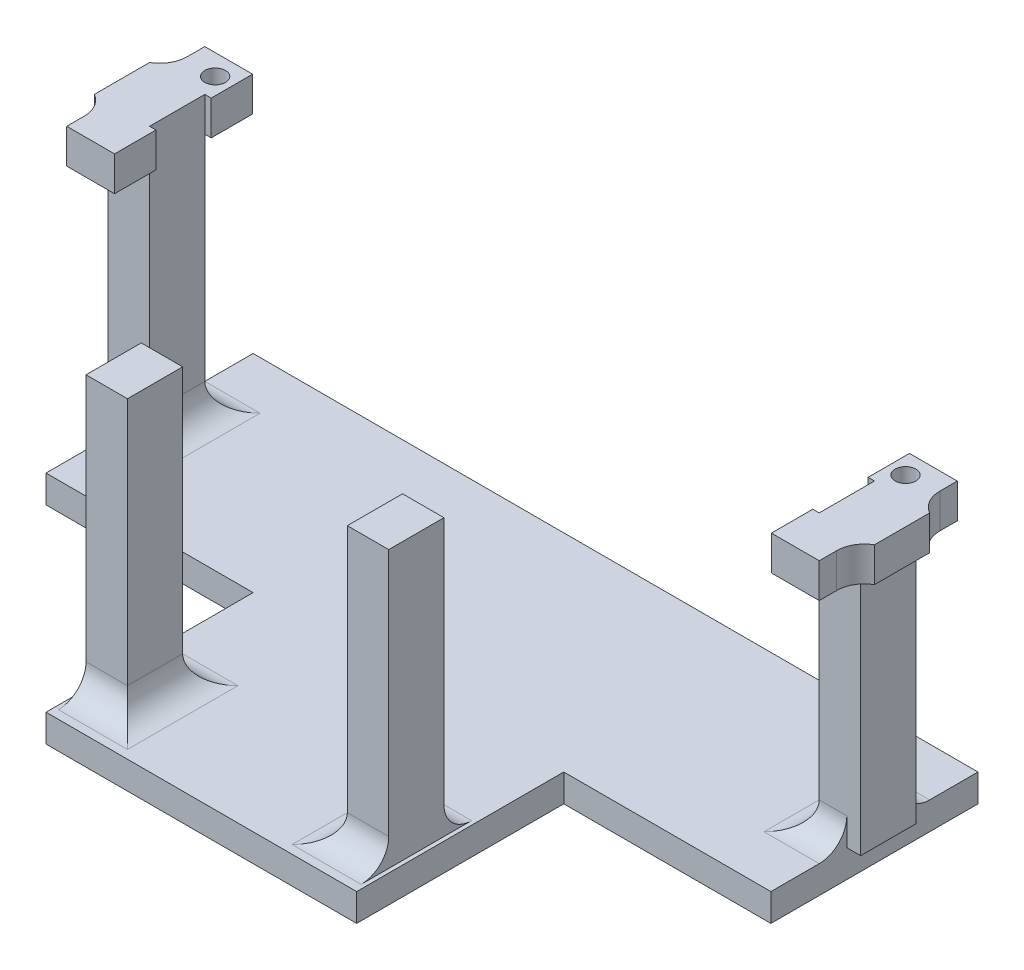
from build123d import *

# Parameters (mm, degrees)
SKETCH1_W            = 45
SKETCH1_H            = 30
BOSS_EXTRUDE1_DEPTH  = 4
SKETCH2_W            = 6
SKETCH2_H            = 8
BOSS_EXTRUDE2_DEPTH  = 40
SKETCH3_W            = 6.928859687
SKETCH3_H            = 6
SKETCH3_R            = 1.5
SKETCH3_W_2          = 2
SKETCH3_H_2          = 8
BOSS_EXTRUDE3_DEPTH  = 5
FILLET2_R            = 4
FILLET3_R            = 4
FILLET2_OF_MIRROR2_R = 4
FILLET3_OF_MIRROR2_R = 4


with BuildPart() as part:
    # Sketch1 → Boss-Extrude1 (new body)
    with BuildSketch(Plane(origin=(0, 0, 0), x_dir=(1, 0, 0), z_dir=(0, 1, 0))):
        Polygon((-22.5, -15), (22.5, -15), (52.5, -15), (52.5, 15), (-52.5, 15), (-52.5, -15), align=None)
        with Locations((0, -30)):
            Rectangle(SKETCH1_W, SKETCH1_H)
    extrude(amount=BOSS_EXTRUDE1_DEPTH)

    # Sketch2 → Boss-Extrude2 (add)
    with BuildSketch(Plane(origin=(0, 4, 0), x_dir=(1, 0, 0), z_dir=(0, 1, 0))):
        with Locations((-51.5, 0)):
            Rectangle(SKETCH2_W, SKETCH2_H)
        with Locations((-18.923893187, -35.779603492)):
            Rectangle(SKETCH2_W, SKETCH2_H)
    boss_extrude2 = extrude(amount=BOSS_EXTRUDE2_DEPTH)

    # Sketch3 → Boss-Extrude3 (add)
    # profile 1 of 3: a face of its own
    with BuildSketch(Plane(origin=(0, 44, 0), x_dir=(1, 0, 0), z_dir=(0, 1, 0))):
        with Locations((-51.035570157, 7)):
            Rectangle(SKETCH3_W, SKETCH3_H)
        with Locations(Location((-50, 7, 0), (0, 0, 270))):
            Circle(SKETCH3_R, mode=Mode.SUBTRACT)
    # profile 2 of 3: a face of its own
    with BuildSketch(Plane(origin=(0, 44, 0), x_dir=(1, 0, 0), z_dir=(0, 1, 0))):
        with Locations((-55.5, 0)):
            Rectangle(SKETCH3_W_2, SKETCH3_H_2)
    # profile 3 of 3: a face of its own
    with BuildSketch(Plane(origin=(0, 44, 0), x_dir=(1, 0, 0), z_dir=(0, 1, 0))):
        with Locations((-51.035570157, -7)):
            Rectangle(SKETCH3_W, SKETCH3_H)
    boss_extrude3 = extrude(amount=-BOSS_EXTRUDE3_DEPTH)

    # Fillet2
    # the kernel refuses this fillet: 4 mm, written as the material it adds along each edge
    with BuildSketch(Plane(origin=(-54.5, 39, -4), x_dir=(0, 0, -1), z_dir=(0, 1, 0))) as fillet2_piece_1:
        with BuildLine():
            CenterArc((3.464101615, 4), FILLET2_R, 210, 60)
            Line((0, 2), (-0.069282032, 1.96))
            ThreePointArc((-0.069282032, 1.96), (-0.08, 1), (-0.08, 0))
            Line((-0.08, 0), (0, -0.08))
            Line((0, -0.08), (3.464101615, -0.08))
            Line((3.464101615, -0.08), (3.464101615, 0))
        make_face()
    extrude(amount=5)
    with BuildSketch(Plane(origin=(-54.5, 39, 4), x_dir=(0, 0, 1), z_dir=(0, 1, 0))) as fillet2_piece_2:
        with BuildLine():
            CenterArc((3.464101615, -4), FILLET2_R, 90, 60)
            Line((0, -2), (-0.069282032, -1.96))
            ThreePointArc((-0.069282032, -1.96), (-0.08, -1), (-0.08, 0))
            Line((-0.08, 0), (0, 0.08))
            Line((0, 0.08), (3.464101615, 0.08))
            Line((3.464101615, 0.08), (3.464101615, 0))
        make_face()
    extrude(amount=5)

    # Fillet3
    fillet3_edges = [part.edges().sort_by_distance(p)[0] for p in [
        (-50.5, 4, 4),
        (-48.5, 4, 0),
        (-50.5, 4, -4),
        (-15.923893187, 4, 35.779603492),
        (-18.923893187, 4, 31.779603492),
        (-18.923893187, 4, 39.779603492),
    ]]
    fillet(fillet3_edges, radius=FILLET3_R)

    # Mirror2: Boss-Extrude2, Boss-Extrude3 across plane
    add(boss_extrude2.mirror(Plane(origin=(0, 0, 0), x_dir=(0, 0, 1), z_dir=(1, 0, 0))))
    add(boss_extrude3.mirror(Plane(origin=(0, 0, 0), x_dir=(0, 0, 1), z_dir=(1, 0, 0))))

    # Fillet2 of Mirror2
    # the kernel refuses this fillet: 4 mm, written as the material it adds along each edge
    with BuildSketch(Plane(origin=(54.5, 39, -4), x_dir=(0, 0, -1), z_dir=(0, 1, 0))) as fillet2_of_mirror2_piece_1:
        with BuildLine():
            CenterArc((3.464101615, -4), FILLET2_OF_MIRROR2_R, 90, 60)
            Line((0, -2), (-0.069282032, -1.96))
            ThreePointArc((-0.069282032, -1.96), (-0.08, -1), (-0.08, 0))
            Line((-0.08, 0), (0, 0.08))
            Line((0, 0.08), (3.464101615, 0.08))
            Line((3.464101615, 0.08), (3.464101615, 0))
        make_face()
    extrude(amount=5)
    with BuildSketch(Plane(origin=(54.5, 39, 4), x_dir=(0, 0, 1), z_dir=(0, 1, 0))) as fillet2_of_mirror2_piece_2:
        with BuildLine():
            CenterArc((3.464101615, 4), FILLET2_OF_MIRROR2_R, 210, 60)
            Line((0, 2), (-0.069282032, 1.96))
            ThreePointArc((-0.069282032, 1.96), (-0.08, 1), (-0.08, 0))
            Line((-0.08, 0), (0, -0.08))
            Line((0, -0.08), (3.464101615, -0.08))
            Line((3.464101615, -0.08), (3.464101615, 0))
        make_face()
    extrude(amount=5)

    # Fillet3 of Mirror2
    fillet3_of_mirror2_edges = [part.edges().sort_by_distance(p)[0] for p in [
        (50.5, 4, 4),
        (48.5, 4, 0),
        (50.5, 4, -4),
        (15.923893187, 4, 35.779603492),
        (18.923893187, 4, 31.779603492),
        (18.923893187, 4, 39.779603492),
    ]]
    fillet(fillet3_of_mirror2_edges, radius=FILLET3_OF_MIRROR2_R)


solid = part.part
